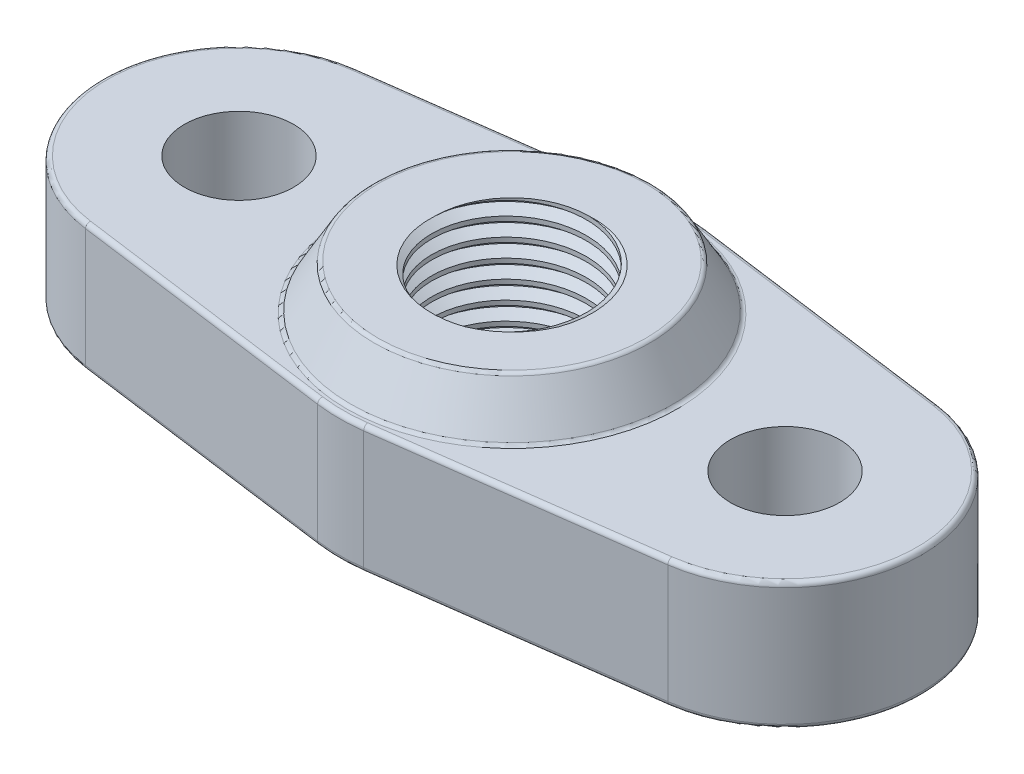
from build123d import *

# Parameters (mm, degrees)
SKETCH1_R             = 12
BOSS_EXTRUDE1_DEPTH   = 28
F_1_0MM_DOWEL_HOLE1_D = 34
THREAD1_PITCH         = 4
FILLET1_R             = 1


with BuildPart() as part:
    # Sketch1 → Boss-Extrude1 (new body)
    with BuildSketch(Plane(origin=(0, 0, 0), x_dir=(1, 0, 0), z_dir=(0, 1, 0))):
        with BuildLine():
            Line((5.066666667, 37.660707493), (64, 29.732137495))
            ThreePointArc((64, 29.732137495), (90, 0), (64, -29.732137495))
            Line((64, -29.732137495), (5.066666667, -37.660707493))
            ThreePointArc((5.066666667, -37.660707493), (0, -38), (-5.066666667, -37.660707493))
            Line((-5.066666667, -37.660707493), (-64, -29.732137495))
            ThreePointArc((-64, -29.732137495), (-90, 0), (-64, 29.732137495))
            Line((-64, 29.732137495), (-5.066666667, 37.660707493))
            ThreePointArc((-5.066666667, 37.660707493), (0, 38), (5.066666667, 37.660707493))
        make_face()
        with Locations(Location((60, 0, 0), (0, 0, 270))):
            Circle(SKETCH1_R, mode=Mode.SUBTRACT)
        with Locations(Location((-60, 0, 0), (0, 0, 90))):
            Circle(SKETCH1_R, mode=Mode.SUBTRACT)
    extrude(amount=BOSS_EXTRUDE1_DEPTH)

    # Sketch2 → Revolve1 (revolve)
    with BuildSketch(Plane.XY, mode=Mode.PRIVATE) as revolve1_sk:
        Polygon((0, 38), (30, 38), (35.773502692, 28), (0, 28), align=None)
    revolve(revolve1_sk.sketch.rotate(Axis((0, 0, 0), (0, -1, 0)), 90), axis=Axis((0, 0, 0), (0, -1, 0)))

    # Ø1.0mm Dowel Hole1 (through all)
    with Locations(Plane.ZX.offset(38)):
        with Locations((0, 0)):
            Hole(F_1_0MM_DOWEL_HOLE1_D / 2)

    # Thread1: the profile of Thread Profile1 profile screwed along a right-hand helix of 10.5 turns, 12 arcs to a turn; built about Z, then put on its axis
    thread1_z = Axis((0, 0, 0), (0, 0, 1))
    thread1_corners = [(16.9997, 0, -0.000173205), (19.1650635, 0, 1.249999995), (19.1650635, 0, 1.749999995), (16.9997, 0, 3.000173194)]
    with BuildLine(mode=Mode.PRIVATE) as thread1_profile:
        Line(thread1_corners[0], thread1_corners[1])
        Line(thread1_corners[1], thread1_corners[2])
        Line(thread1_corners[2], thread1_corners[3])
        Line(thread1_corners[3], thread1_corners[0])
    thread1_cap = Face(thread1_profile.wire())
    thread1_turn_angles = [0, 15, 30, 45, 60, 75, 90, 105, 120, 135, 150, 165, 180, 195, 210, 225, 240, 255, 270, 285, 300, 315, 330, 345, 360]
    thread1_turn_weights = [1, 0.9659258262890683, 1, 0.9659258262890683, 1, 0.9659258262890683, 1, 0.9659258262890683, 1, 0.9659258262890683, 1, 0.9659258262890683, 1, 0.9659258262890683, 1, 0.9659258262890683, 1, 0.9659258262890683, 1, 0.9659258262890683, 1, 0.9659258262890683, 1, 0.9659258262890683, 1]
    thread1_turn_rails = [Edge.make_bspline([Vector(p[0], p[1], 0).rotate(thread1_z, thread1_turn_angles[k]) / thread1_turn_weights[k] + Vector(0, 0, p[2] + THREAD1_PITCH * thread1_turn_angles[k] / 360) for k in range(25)], [0, 0, 0, 1, 1, 2, 2, 3, 3, 4, 4, 5, 5, 6, 6, 7, 7, 8, 8, 9, 9, 10, 10, 11, 11, 12, 12, 12], 2, thread1_turn_weights) for p in thread1_corners]
    thread1_turn_sides = [Face.make_surface_from_curves(thread1_turn_rails[p[0]], thread1_turn_rails[p[1]]) for p in [(0, 1), (1, 2), (2, 3), (3, 0)]]
    thread1_last_angles = [3600, 3615, 3630, 3645, 3660, 3675, 3690, 3705, 3720, 3735, 3750, 3765, 3780]
    thread1_last_weights = [1, 0.9659258262890683, 1, 0.9659258262890683, 1, 0.9659258262890683, 1, 0.9659258262890683, 1, 0.9659258262890683, 1, 0.9659258262890693, 1]
    thread1_last_rails = [Edge.make_bspline([Vector(p[0], p[1], 0).rotate(thread1_z, thread1_last_angles[k]) / thread1_last_weights[k] + Vector(0, 0, p[2] + THREAD1_PITCH * thread1_last_angles[k] / 360) for k in range(13)], [0, 0, 0, 1, 1, 2, 2, 3, 3, 4, 4, 5, 5, 6, 6, 6], 2, thread1_last_weights) for p in thread1_corners]
    thread1_last_sides = [Face.make_surface_from_curves(thread1_last_rails[p[0]], thread1_last_rails[p[1]]) for p in [(0, 1), (1, 2), (2, 3), (3, 0)]]
    thread1 = Plane(origin=(0, 42, 0), x_dir=(-1, 0, 0), z_dir=(0, -1, 0)) * Solid(Shell([*[p.moved(Location((0, 0, THREAD1_PITCH * i))) for i in range(10) for p in thread1_turn_sides], *thread1_last_sides, thread1_cap, thread1_cap.rotate(thread1_z, 3780).moved(Location((0, 0, THREAD1_PITCH * 3780 / 360)))]))
    add(thread1, mode=Mode.SUBTRACT)

    # Fillet1
    fillet1_edges = [part.edges().sort_by_distance(p)[0] for p in [
        (-34.533333333, 0, 33.696422494),
        (-90, 0, 0),
        (-34.533333333, 0, -33.696422494),
        (0, 0, -38),
        (-90, 28, 0),
        (-34.533333333, 28, 33.696422494),
        (0, 28, 38),
        (34.533333333, 28, 33.696422494),
        (90, 28, 0),
        (34.533333333, 28, -33.696422494),
        (0, 38, -30),
        (0, 28, -35.773502692),
        (0, 28, -38),
        (34.533333333, 0, -33.696422494),
        (-34.533333333, 28, -33.696422494),
        (90, 0, 0),
        (34.533333333, 0, 33.696422494),
        (0, 0, 38),
    ]]
    fillet(fillet1_edges, radius=FILLET1_R)


solid = part.part
